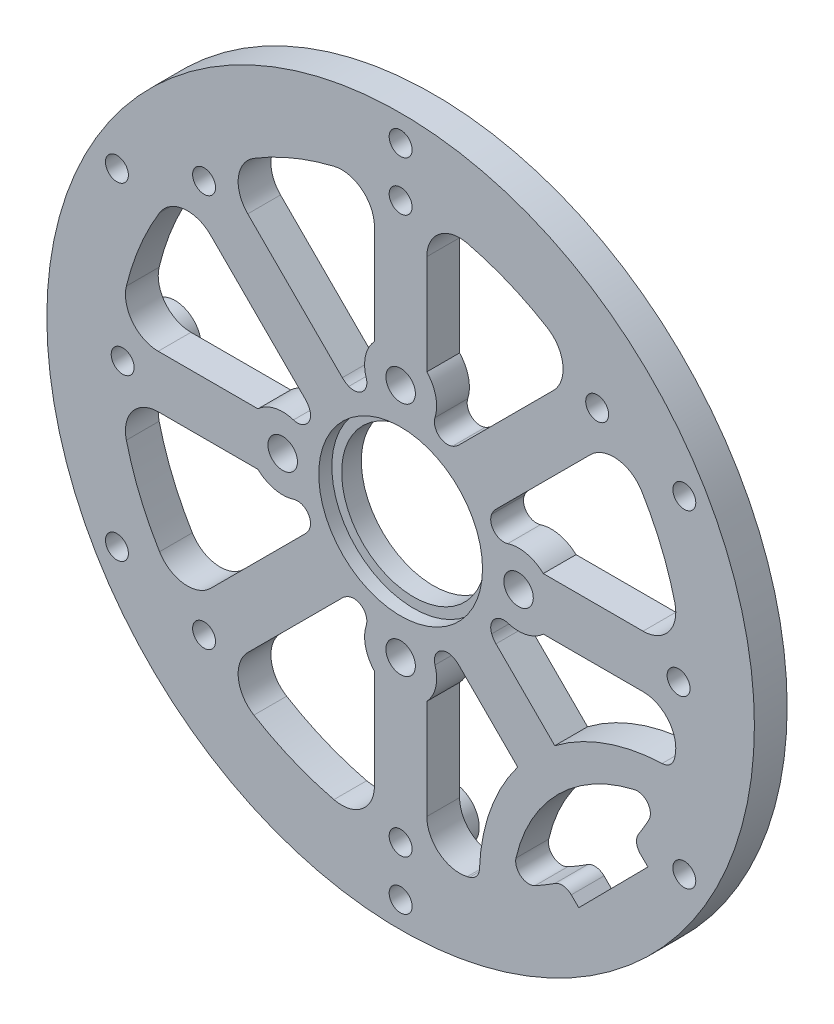
from build123d import *

# Parameters (mm, degrees)
SKETCH1_R                = 54
BOSS_EXTRUDE1_DEPTH      = 5
CUT_EXTRUDE4_DEPTH       = 10
SKETCH3_R                = 2.25
CUT_EXTRUDE5_DEPTH       = 10
SKETCH4_R                = 1.75
CUT_EXTRUDE6_DEPTH       = 10
FILLET1_R                = 5
FILLET3_R                = 3
SKETCH5_R                = 11
CUT_EXTRUDE7_DEPTH       = 10
SKETCH6_R                = 45.5
SKETCH6_R_2              = 43.5
BOSS_EXTRUDE2_DEPTH      = 5
CUT_EXTRUDE8_DEPTH       = 7.5
CIRPATTERN1_COUNT        = 8
CUT_EXTRUDE9_START       = -10
CUT_EXTRUDE9_DEPTH       = 10
CUT_EXTRUDE11_DEPTH      = 91.188379779
CUT_EXTRUDE11_DEPTH_BACK = 91.188379779
SKETCH13_W               = 15
SKETCH13_H               = 10
BOSS_EXTRUDE3_START      = -5
BOSS_EXTRUDE3_DEPTH      = 5
FILLET4_R                = 2
FILLET5_R                = 2
FILLET6_R                = 2
BOSS_EXTRUDE4_START      = -5
SKETCH16_R               = 5.5
SKETCH16_R_2             = 2.25
BOSS_EXTRUDE4_DEPTH      = 5
FILLET7_R                = 2
SKETCH17_R               = 12.5
CUT_EXTRUDE12_DEPTH      = 2
SKETCH18_R               = 1.75
SKETCH18_R_2             = 4
BOSS_EXTRUDE5_DEPTH      = 3
CIRPATTERN2_START        = -3
CIRPATTERN2_OUTLINE_R    = 4
CIRPATTERN2_OUTLINE_R_2  = 1.75
CIRPATTERN2_DEPTH        = 8.0000001


with BuildPart() as part:
    # Sketch1 → Boss-Extrude1 (new body)
    with BuildSketch(Plane.XY):
        Circle(SKETCH1_R)
    extrude(amount=BOSS_EXTRUDE1_DEPTH)

    # Sketch2 → Cut-Extrude4 (cut)
    with BuildSketch(Plane.XY.offset(5)):
        with BuildLine():
            ThreePointArc((-7.394097025, 13.050951275), (-5.740251485, 13.858192988), (-4, 14.456832295))
            Line((-4, 14.456832295), (-4, 42.893897002))
            ThreePointArc((-4, 42.893897002), (-16.486002266, 39.800730261), (-27.502138317, 33.158992566))
            Line((-27.502138317, 33.158992566), (-7.394097025, 13.050951275))
        make_face()
        with BuildLine():
            Line((4, 42.893897002), (4, 14.456832295))
            ThreePointArc((4, 14.456832295), (5.740251485, 13.858192988), (7.394097025, 13.050951275))
            Line((7.394097025, 13.050951275), (27.502138317, 33.158992566))
            ThreePointArc((27.502138317, 33.158992566), (16.486002266, 39.800730261), (4, 42.893897002))
        make_face()
        with BuildLine():
            Line((33.158992566, 27.502138317), (13.050951275, 7.394097025))
            ThreePointArc((13.050951275, 7.394097025), (13.858192988, 5.740251485), (14.456832295, 4))
            Line((14.456832295, 4), (42.893897002, 4))
            ThreePointArc((42.893897002, 4), (39.800730261, 16.486002266), (33.158992566, 27.502138317))
        make_face()
        with BuildLine():
            Line((42.893897002, -4), (14.456832295, -4))
            ThreePointArc((14.456832295, -4), (13.858192988, -5.740251485), (13.050951275, -7.394097025))
            Line((13.050951275, -7.394097025), (33.158992566, -27.502138317))
            ThreePointArc((33.158992566, -27.502138317), (39.800730261, -16.486002266), (42.893897002, -4))
        make_face()
        with BuildLine():
            Line((27.502138317, -33.158992566), (7.394097025, -13.050951275))
            ThreePointArc((7.394097025, -13.050951275), (5.740251485, -13.858192988), (4, -14.456832295))
            Line((4, -14.456832295), (4, -42.893897002))
            ThreePointArc((4, -42.893897002), (16.486002266, -39.800730261), (27.502138317, -33.158992566))
        make_face()
        with BuildLine():
            ThreePointArc((-4, -14.456832295), (-5.740251485, -13.858192988), (-7.394097025, -13.050951275))
            Line((-7.394097025, -13.050951275), (-27.502138317, -33.158992566))
            ThreePointArc((-27.502138317, -33.158992566), (-16.486002266, -39.800730261), (-4, -42.893897002))
            Line((-4, -42.893897002), (-4, -14.456832295))
        make_face()
        with BuildLine():
            ThreePointArc((-13.050951275, -7.394097025), (-13.858192988, -5.740251485), (-14.456832295, -4))
            Line((-14.456832295, -4), (-42.893897002, -4))
            ThreePointArc((-42.893897002, -4), (-39.800730261, -16.486002266), (-33.158992566, -27.502138317))
            Line((-33.158992566, -27.502138317), (-13.050951275, -7.394097025))
        make_face()
        with BuildLine():
            ThreePointArc((-14.456832295, 4), (-13.858192988, 5.740251485), (-13.050951275, 7.394097025))
            Line((-13.050951275, 7.394097025), (-33.158992566, 27.502138317))
            ThreePointArc((-33.158992566, 27.502138317), (-39.800730261, 16.486002266), (-42.893897002, 4))
            Line((-42.893897002, 4), (-14.456832295, 4))
        make_face()
    extrude(amount=-CUT_EXTRUDE4_DEPTH, mode=Mode.SUBTRACT)

    # Sketch3 → Cut-Extrude5 (cut)
    with BuildSketch(Plane.XY.offset(5)):
        with Locations((0, 18)):
            Circle(SKETCH3_R)
        with Locations((18, 0)):
            Circle(SKETCH3_R)
        with Locations((0, -18)):
            Circle(SKETCH3_R)
        with Locations((-18, 0)):
            Circle(SKETCH3_R)
    extrude(amount=-CUT_EXTRUDE5_DEPTH, mode=Mode.SUBTRACT)

    # Sketch4 → Cut-Extrude6 (cut)
    with BuildSketch(Plane.XY.offset(5)):
        with Locations((0, 50)):
            Circle(SKETCH4_R)
        with Locations((43.301270189, 25)):
            Circle(SKETCH4_R)
        with Locations((43.301270189, -25)):
            Circle(SKETCH4_R)
        with Locations((0, -50)):
            Circle(SKETCH4_R)
        with Locations((-43.301270189, -25)):
            Circle(SKETCH4_R)
        with Locations((-43.301270189, 25)):
            Circle(SKETCH4_R)
    extrude(amount=-CUT_EXTRUDE6_DEPTH, mode=Mode.SUBTRACT)

    # Fillet1
    fillet1_edges = [part.edges().sort_by_distance(p)[0] for p in [
        (-33.158992566, 27.502138317, 2.5),
        (-42.893897002, 4, 2.5),
        (-27.502138317, -33.158992566, 2.5),
        (-4, -42.893897002, 2.5),
        (-42.893897002, -4, 2.5),
        (-33.158992566, -27.502138317, 2.5),
        (33.158992566, -27.502138317, 2.5),
        (42.893897002, -4, 2.5),
        (4, -42.893897002, 2.5),
        (27.502138317, -33.158992566, 2.5),
        (27.502138317, 33.158992566, 2.5),
        (4, 42.893897002, 2.5),
        (42.893897002, 4, 2.5),
        (33.158992566, 27.502138317, 2.5),
        (-4, 42.893897002, 2.5),
        (-27.502138317, 33.158992566, 2.5),
    ]]
    fillet(fillet1_edges, radius=FILLET1_R)

    # Fillet3
    # the kernel refuses this fillet: 3 mm, written as the material it adds along each edge
    with BuildSketch(Plane(origin=(-14.456832295, -4, 5), x_dir=(-1, 0, 0), z_dir=(0, 0, -1)), Plane(origin=(-7.394097025, -13.050951275, 5), x_dir=(-0.7071067811865792, -0.7071067811865157, 0), z_dir=(0, 0, -1)), Plane(origin=(4, -14.456832295, 5), x_dir=(0, -1, 0), z_dir=(0, 0, -1)), Plane(origin=(13.050951275, -7.394097025, 5), x_dir=(0.7071067811865726, -0.7071067811865225, 0), z_dir=(0, 0, -1)), Plane(origin=(14.456832295, 4, 5), x_dir=(1, 0, 0), z_dir=(0, 0, -1)), Plane(origin=(7.394097025, 13.050951275, 5), x_dir=(0.7071067811865331, 0.707106781186562, 0), z_dir=(0, 0, -1)), Plane(origin=(-4, 14.456832295, 5), x_dir=(0, 1, 0), z_dir=(0, 0, -1)), Plane(origin=(-13.050951275, 7.394097025, 5), x_dir=(-0.7071067811865053, 0.7071067811865897, 0), z_dir=(0, 0, -1))) as fillet3_piece_1:
        with BuildLine():
            CenterArc((2.126291657, -3), FILLET3_R, 90, 67.114619524)
            ThreePointArc((-0.637562335, -1.833333333), (-0.289095445, -0.926990211), (0, 0))
            Line((0, 0), (2.126291657, 0))
        make_face()
    extrude(amount=5)
    with BuildSketch(Plane(origin=(-13.050951275, -7.394097025, 5), x_dir=(-0.4356129740982292, 0.900134066013111, 0), z_dir=(0, 0, -1)), Plane(origin=(-4, -14.456832295, 5), x_dir=(-0.9445157900125684, 0.32846601409724885, 0), z_dir=(0, 0, -1)), Plane(origin=(14.456832295, -4, 5), x_dir=(-0.3284660140975722, -0.9445157900124558, 0), z_dir=(0, 0, -1)), Plane(origin=(13.050951275, 7.394097025, 5), x_dir=(0.4356129740977994, -0.9001340660133189, 0), z_dir=(0, 0, -1)), Plane(origin=(4, 14.456832295, 5), x_dir=(0.9445157900124527, -0.32846601409758125, 0), z_dir=(0, 0, -1)), Plane(origin=(-7.394097025, 13.050951275, 5), x_dir=(0.9001340660132181, 0.43561297409800753, 0), z_dir=(0, 0, -1)), Plane(origin=(-14.456832295, 4, 5), x_dir=(0.32846601409726156, 0.9445157900125638, 0), z_dir=(0, 0, -1))) as fillet3_piece_2:
        with BuildLine():
            CenterArc((2.135132825, -2.993714086), FILLET3_R, 93.709685261, 67.114619524)
            Line((-0.698414545, -2.008316044), (0, 0))
            ThreePointArc((0, 0), (0.97051492, -0.031429568), (1.941029841, 0))
        make_face()
    extrude(amount=5)
    with BuildSketch(Plane(origin=(7.394097025, -13.050951275, 5), x_dir=(0.7071067811865624, -0.7071067811865328, 0), z_dir=(0, 0, -1))) as fillet3_piece_3:
        with BuildLine():
            CenterArc((2.126291657, 3), FILLET3_R, 202.885380476, 67.114619524)
            ThreePointArc((-0.637562335, 1.833333333), (-0.289095445, 0.926990211), (0, 0))
            Line((0, 0), (2.126291657, 0))
        make_face()
    extrude(amount=5)

    # Sketch5 → Cut-Extrude7 (cut)
    with BuildSketch(Plane.XY.offset(5)):
        Circle(SKETCH5_R)
    extrude(amount=-CUT_EXTRUDE7_DEPTH, mode=Mode.SUBTRACT)

    # Sketch6 → Boss-Extrude2 (add)
    with BuildSketch(Plane.XY.offset(5)):
        Circle(SKETCH6_R)
        Circle(SKETCH6_R_2, mode=Mode.SUBTRACT)
    extrude(amount=-BOSS_EXTRUDE2_DEPTH)

    # Sketch7 → Cut-Extrude8 (cut)
    with BuildSketch(Plane.XY.offset(5)):
        with BuildLine():
            Line((-30, 28.25), (-30, 30))
            Line((-30, 30), (-28.25, 30))
            ThreePointArc((-28.25, 30), (-31.237436867, 31.237436867), (-30, 28.25))
        make_face()
        with BuildLine():
            Line((-28.25, 30), (-30, 30))
            Line((-30, 30), (-30, 28.25))
            ThreePointArc((-30, 28.25), (-28.762563133, 28.762563133), (-28.25, 30))
        make_face()
    cut_extrude8 = extrude(amount=-CUT_EXTRUDE8_DEPTH, mode=Mode.SUBTRACT)

    # CirPattern1: Cut-Extrude8 ×8 about axis
    cirpattern1_axis = Axis((0, 0, 0), (0, 0, 1))
    for i in range(1, CIRPATTERN1_COUNT):
        add(cut_extrude8.rotate(cirpattern1_axis, i * 360 / CIRPATTERN1_COUNT), mode=Mode.SUBTRACT)

    # Sketch9 → Cut-Extrude9 (cut)
    with BuildSketch(Plane(origin=(0, 0, 0), x_dir=(-1, 0, 0), z_dir=(0, 0, -1)).offset(CUT_EXTRUDE9_START)):
        with BuildLine():
            Line((-26.047884483, -20.391030233), (-36.798711455, -22.39958114))
            ThreePointArc((-36.798711455, -22.39958114), (-30.462160134, -30.462160134), (-22.39958114, -36.798711455))
            Line((-22.39958114, -36.798711455), (-20.391030233, -26.047884483))
            ThreePointArc((-20.391030233, -26.047884483), (-23.391092322, -23.391092322), (-26.047884483, -20.391030233))
        make_face()
    extrude(amount=CUT_EXTRUDE9_DEPTH, mode=Mode.SUBTRACT)

    # Sketch13 → Cut-Extrude11 (cut, two sides: drawn at the far end of the back side and taken through both)
    with BuildSketch(Plane(origin=(7.604244558, -7.524376901, -18.528959742), x_dir=(-0.7033639917323762, -0.7108298637045983, 0), z_dir=(0.3554149318522999, -0.3516819958661888, -0.866025403784438)).offset(-CUT_EXTRUDE11_DEPTH_BACK)):
        with Locations((0, -37.057919485)):
            Rectangle(SKETCH13_W, SKETCH13_H)
    extrude(amount=CUT_EXTRUDE11_DEPTH + CUT_EXTRUDE11_DEPTH_BACK, mode=Mode.SUBTRACT)

    # Sketch15 → Boss-Extrude3 (add)
    with BuildSketch(Plane(origin=(0, 0, 0), x_dir=(-1, 0, 0), z_dir=(0, 0, -1)).offset(BOSS_EXTRUDE3_START)):
        with BuildLine():
            ThreePointArc((-17.056184089, -39.559739437), (-24.04163056, -24.04163056), (-39.559739437, -17.056184089))
            ThreePointArc((-39.559739437, -17.056184089), (-40.543699656, -14.563475484), (-41.370766822, -12.014410203))
            ThreePointArc((-41.370766822, -12.014410203), (-20.506096654, -20.506096654), (-12.014410203, -41.370766822))
            ThreePointArc((-12.014410203, -41.370766822), (-14.563475484, -40.543699656), (-17.056184089, -39.559739437))
        make_face()
    extrude(amount=BOSS_EXTRUDE3_DEPTH)

    # Fillet4
    fillet4_edges = [part.edges().sort_by_distance(p)[0] for p in [
        (17.056184089, -39.559739437, 2.5),
        (39.559739437, -17.056184089, 2.5),
    ]]
    fillet(fillet4_edges, radius=FILLET4_R)

    # Fillet5
    fillet5_edges = [part.edges().sort_by_distance(p)[0] for p in [
        (41.370766822, -12.014410203, 2.5),
        (12.014410203, -41.370766822, 2.5),
    ]]
    fillet(fillet5_edges, radius=FILLET5_R)

    # Fillet6
    fillet6_edges = [part.edges().sort_by_distance(p)[0] for p in [
        (35.430140844, -24.5069688, 2.5),
        (24.879680968, -35.169416755, 2.5),
    ]]
    fillet(fillet6_edges, radius=FILLET6_R)

    # Sketch16 → Boss-Extrude4 (add)
    # profile 1 of 4: a face of its own
    with BuildSketch(Plane(origin=(0, 0, 0), x_dir=(-1, 0, 0), z_dir=(0, 0, -1)).offset(BOSS_EXTRUDE4_START)):
        with Locations((-18, 0)):
            Circle(SKETCH16_R)
        with Locations(Location((-18, 0, 0), (0, 0, 180))):
            Circle(SKETCH16_R_2, mode=Mode.SUBTRACT)
    # profile 2 of 4: a face of its own
    with BuildSketch(Plane(origin=(0, 0, 0), x_dir=(-1, 0, 0), z_dir=(0, 0, -1)).offset(BOSS_EXTRUDE4_START)):
        with Locations((0, 18)):
            Circle(SKETCH16_R)
        with Locations(Location((0, 18, 0), (0, 0, 180))):
            Circle(SKETCH16_R_2, mode=Mode.SUBTRACT)
    # profile 3 of 4: a face of its own
    with BuildSketch(Plane(origin=(0, 0, 0), x_dir=(-1, 0, 0), z_dir=(0, 0, -1)).offset(BOSS_EXTRUDE4_START)):
        with Locations((18, 0)):
            Circle(SKETCH16_R)
        with Locations(Location((18, 0, 0), (0, 0, 180))):
            Circle(SKETCH16_R_2, mode=Mode.SUBTRACT)
    # profile 4 of 4: a face of its own
    with BuildSketch(Plane(origin=(0, 0, 0), x_dir=(-1, 0, 0), z_dir=(0, 0, -1)).offset(BOSS_EXTRUDE4_START)):
        with Locations((0, -18)):
            Circle(SKETCH16_R)
        with Locations(Location((0, -18, 0), (0, 0, 180))):
            Circle(SKETCH16_R_2, mode=Mode.SUBTRACT)
    extrude(amount=BOSS_EXTRUDE4_DEPTH)

    # Fillet7
    fillet7_edges = [part.edges().sort_by_distance(p)[0] for p in [
        (-14.880649429, 4.529862251, 2.5),
        (-14.880649429, -4.529862251, 2.5),
        (-4.529862251, -14.880649429, 2.5),
        (4.529862251, -14.880649429, 2.5),
        (14.880649429, -4.529862251, 2.5),
        (14.880649429, 4.529862251, 2.5),
        (4.529862251, 14.880649429, 2.5),
        (-4.529862251, 14.880649429, 2.5),
    ]]
    fillet(fillet7_edges, radius=FILLET7_R)

    # Sketch17 → Cut-Extrude12 (cut)
    with BuildSketch(Plane.XY.offset(5)):
        Circle(SKETCH17_R)
    extrude(amount=-CUT_EXTRUDE12_DEPTH, mode=Mode.SUBTRACT)

    # Sketch18 → Boss-Extrude5 (add)
    # profile 1 of 4: a face of its own
    with BuildSketch(Plane(origin=(0, 0, 0), x_dir=(-1, 0, 0), z_dir=(0, 0, -1))):
        with Locations(Location((0, -42.426406871, 0), (0, 0, 180))):
            Circle(SKETCH18_R)
    # profile 2 of 4: a face of its own
    with BuildSketch(Plane(origin=(0, 0, 0), x_dir=(-1, 0, 0), z_dir=(0, 0, -1))):
        with Locations(Location((42.426406871, 0, 0), (0, 0, 180))):
            Circle(SKETCH18_R)
    # profile 3 of 4: a face of its own
    with BuildSketch(Plane(origin=(0, 0, 0), x_dir=(-1, 0, 0), z_dir=(0, 0, -1))):
        with Locations(Location((-42.426406871, 0, 0), (0, 0, 180))):
            Circle(SKETCH18_R)
    # profile 4 of 4: a face of its own
    with BuildSketch(Plane(origin=(0, 0, 0), x_dir=(-1, 0, 0), z_dir=(0, 0, -1))):
        with Locations(Location((0, 42.426406871, 0), (0, 0, 180))):
            Circle(SKETCH18_R_2)
        with Locations(Location((0, 42.426406871, 0), (0, 0, 225))):
            Circle(SKETCH18_R, mode=Mode.SUBTRACT)
    extrude(amount=BOSS_EXTRUDE5_DEPTH)


with BuildPart() as boss_extrude5_kept_piece:
    # of the separate pieces the step leaves, the one the design keeps (boss_extrude5_pieces_kept)
    add(part.part.solids().sort_by_distance((54, 0, 5))[0])

    # CirPattern2: read off the stored shape, not the designer's step
    # CirPattern2 outline → CirPattern2 (add)
    # profile 1 of 3: a face of its own
    with BuildSketch(Plane.XY.offset(CIRPATTERN2_START)):
        with Locations((-42.426406871, 0)):
            Circle(CIRPATTERN2_OUTLINE_R)
        with Locations((-42.426406871, 0)):
            Circle(CIRPATTERN2_OUTLINE_R_2, mode=Mode.SUBTRACT)
    # profile 2 of 3: a face of its own
    with BuildSketch(Plane.XY.offset(CIRPATTERN2_START)):
        with Locations((0, -42.426406871)):
            Circle(CIRPATTERN2_OUTLINE_R)
        with Locations((0, -42.426406871)):
            Circle(CIRPATTERN2_OUTLINE_R_2, mode=Mode.SUBTRACT)
    # profile 3 of 3: a face of its own
    with BuildSketch(Plane.XY.offset(CIRPATTERN2_START)):
        with Locations((42.426406871, 0)):
            Circle(CIRPATTERN2_OUTLINE_R)
        with Locations((42.426406871, 0)):
            Circle(CIRPATTERN2_OUTLINE_R_2, mode=Mode.SUBTRACT)
    extrude(amount=CIRPATTERN2_DEPTH)


solid = boss_extrude5_kept_piece.part
